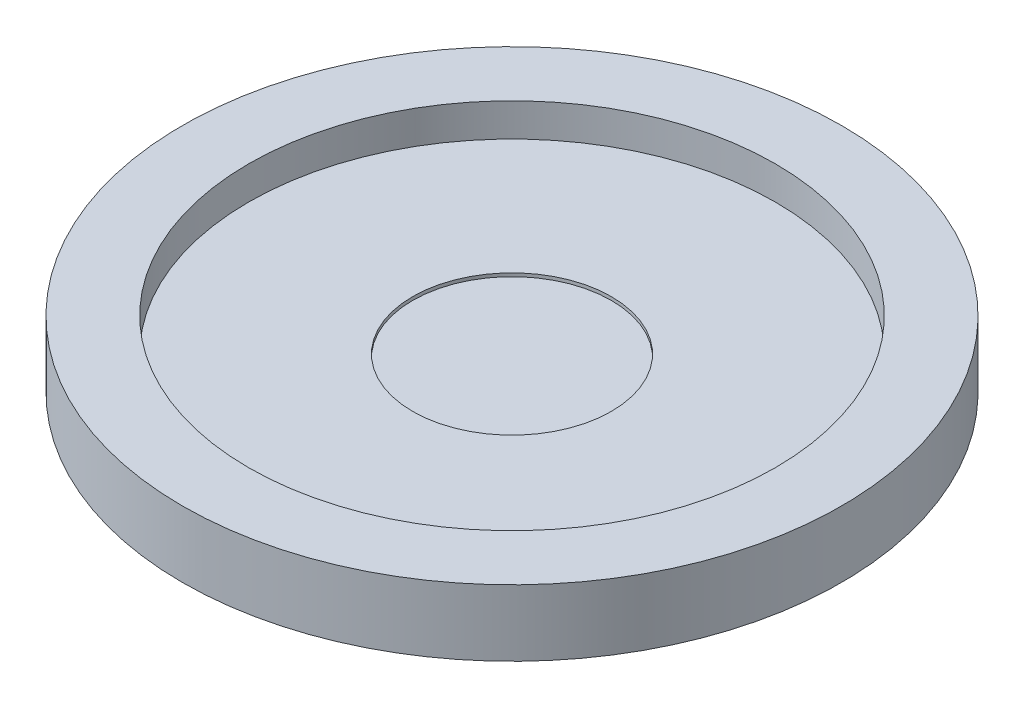
from build123d import *

# Parameters (mm, degrees)
SKETCH1_R           = 9945.75
BOSS_EXTRUDE1_DEPTH = 2000
SKETCH2_R           = 7945.75
CUT_EXTRUDE1_DEPTH  = 1000
SKETCH3_R           = 3000
CUT_EXTRUDE2_DEPTH  = 100


with BuildPart() as part:
    # Sketch1 → Boss-Extrude1 (new body)
    with BuildSketch(Plane(origin=(0, 0, 0), x_dir=(1, 0, 0), z_dir=(0, 1, 0))):
        Circle(SKETCH1_R)
    extrude(amount=BOSS_EXTRUDE1_DEPTH)

    # Sketch2 → Cut-Extrude1 (cut)
    with BuildSketch(Plane(origin=(0, 2000, 0), x_dir=(1, 0, 0), z_dir=(0, 1, 0))):
        Circle(SKETCH2_R)
    extrude(amount=-CUT_EXTRUDE1_DEPTH, mode=Mode.SUBTRACT)

    # Sketch3 → Cut-Extrude2 (cut)
    with BuildSketch(Plane(origin=(0, 1000, 0), x_dir=(1, 0, 0), z_dir=(0, 1, 0))):
        Circle(SKETCH3_R)
    extrude(amount=-CUT_EXTRUDE2_DEPTH, mode=Mode.SUBTRACT)


solid = part.part
